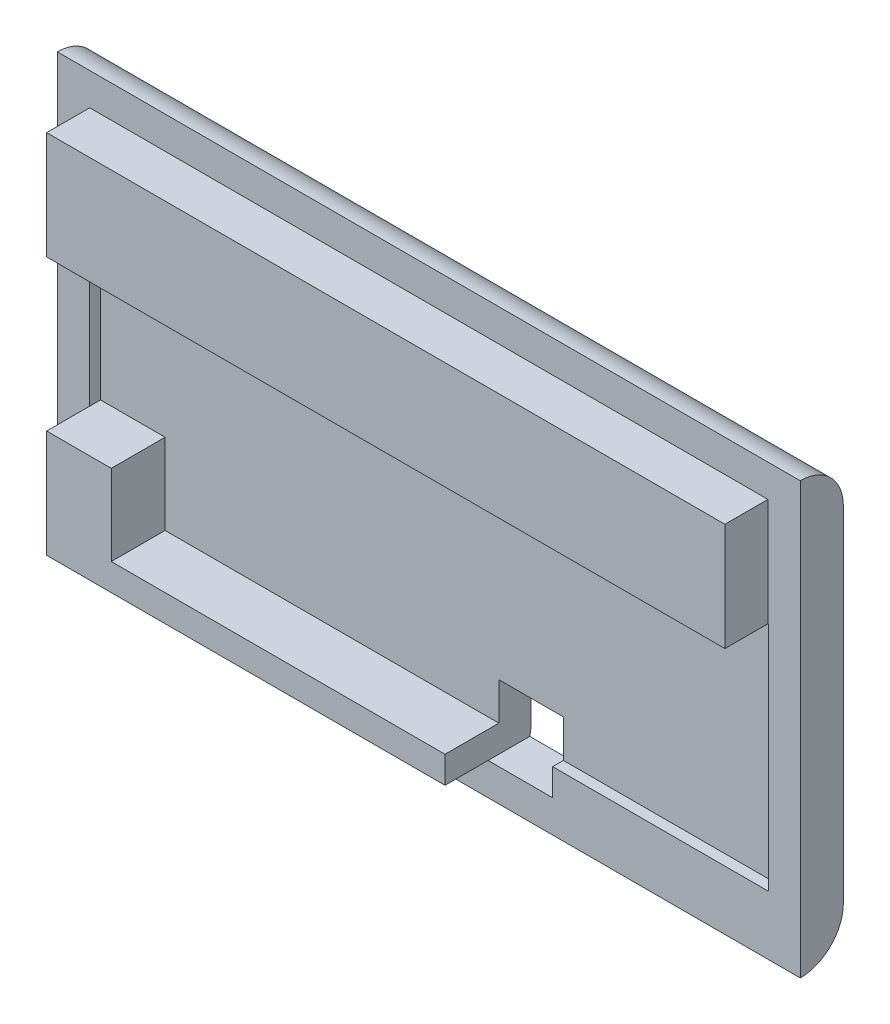
from build123d import *

# Parameters (mm, degrees)
SKETCH1_W           = 34.5
SKETCH1_H           = 20
BOSS_EXTRUDE1_DEPTH = 2
SKETCH2_W           = 31.5
SKETCH2_H           = 5
BOSS_EXTRUDE2_DEPTH = 2
SKETCH3_W           = 3
SKETCH3_H           = 3
CUT_EXTRUDE1_DEPTH  = 10
FILLET1_R           = 2
CUT_EXTRUDE2_DEPTH  = 2
CUT_EXTRUDE3_DEPTH  = 2.5


with BuildPart() as part:
    # Sketch1 → Boss-Extrude1 (new body)
    with BuildSketch(Plane.XY):
        Rectangle(SKETCH1_W, SKETCH1_H)
    extrude(amount=BOSS_EXTRUDE1_DEPTH)

    # Sketch2 → Boss-Extrude2 (add)
    with BuildSketch(Plane.XY.offset(2)):
        with Locations((0, 6)):
            Rectangle(SKETCH2_W, SKETCH2_H)
        with Locations((0, -6)):
            Rectangle(SKETCH2_W, SKETCH2_H)
    extrude(amount=BOSS_EXTRUDE2_DEPTH)

    # Sketch3 → Cut-Extrude1 (cut)
    with BuildSketch(Plane(origin=(0, 0, 0), x_dir=(-1, 0, 0), z_dir=(0, 0, -1))):
        with Locations((-4.25, -7)):
            Rectangle(SKETCH3_W, SKETCH3_H)
    extrude(amount=-CUT_EXTRUDE1_DEPTH, mode=Mode.SUBTRACT)

    # Fillet1
    # the kernel refuses this fillet: 2 mm, written as the material it takes off along each edge
    with BuildSketch(Plane(origin=(22.25, -10, 0), x_dir=(0, 1, 0), z_dir=(-1, 0, 0))) as fillet1_piece_1:
        with BuildLine():
            CenterArc((FILLET1_R, -FILLET1_R), FILLET1_R, 90, 90)
            Line((0, -FILLET1_R), (0, 0))
            Line((0, 0), (FILLET1_R, 0))
        make_face()
    extrude(amount=44.5, mode=Mode.SUBTRACT)
    with BuildSketch(Plane(origin=(-22.25, 10, 0), x_dir=(0, 0, 1), z_dir=(1, 0, 0))) as fillet1_piece_2:
        with BuildLine():
            CenterArc((FILLET1_R, FILLET1_R), FILLET1_R, 180, 90)
            Line((0, FILLET1_R), (0, 0))
            Line((0, 0), (FILLET1_R, 0))
        make_face()
    extrude(amount=44.5, mode=Mode.SUBTRACT)

    # Sketch4 → Cut-Extrude2 (cut)
    with BuildSketch(Plane.XY.offset(4)):
        Polygon((15.75, -8.5), (5.75, -8.5), (5.75, -5.5), (-12.75, -5.5), (-12.75, -3.5), (5.75, -3.5), (15.75, -3.5), align=None)
    extrude(amount=-CUT_EXTRUDE2_DEPTH, mode=Mode.SUBTRACT)

    # Sketch6 → Cut-Extrude3 (cut)
    with BuildSketch(Plane.XY.offset(4)):
        Polygon((-15.75, 3.5), (15.762886562, 3.5), (15.762886562, -7.25), (-12.75, -7.25), (-12.75, -3.5), (-15.75, -3.5), align=None)
    extrude(amount=-CUT_EXTRUDE3_DEPTH, mode=Mode.SUBTRACT)


solid = part.part
